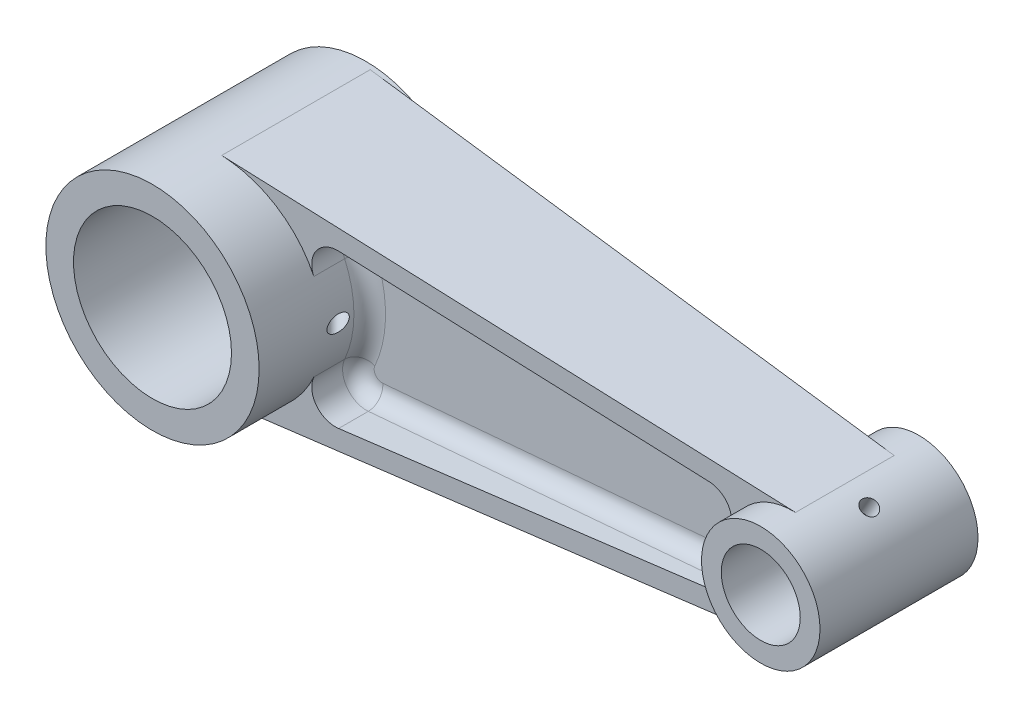
from build123d import *

# Parameters (mm, degrees)
SKETCH_2_R                  = 13.5
EXTRUDE_1_DEPTH             = 27
SKETCH_3_R                  = 7.5
EXTRUDE_2_DEPTH             = 20
EXTRUDE_START               = 10
EXTRUDE_3_DEPTH             = 3
EXTRUDE_4_REACH             = 83.17
EXTRUDE_4_DIRECTION_2_REACH = 83.17
FILLET_1_R                  = 3
SKETCH_7_R                  = 10
CUT_EXTRUDE_1_DEPTH         = 84.171509545
SKETCH_8_R                  = 5
CUT_EXTRUDE_2_DEPTH         = 82.169575581
SWEEP_1_PROFILE_R           = 1
FILLET_2_R                  = 2
SWEEP_2_PROFILE_R           = 1


with BuildPart() as part:
    # 草图2 → 凸台-拉伸1 (new body)
    with BuildSketch(Plane.XY):
        Circle(SKETCH_2_R)
    extrude(amount=EXTRUDE_1_DEPTH)



with BuildPart() as body_2:
    # 草图3 → 凸台-拉伸2 (new body)
    with BuildSketch(Plane.XY):
        with Locations((70, 0)):
            Circle(SKETCH_3_R)
    extrude(amount=EXTRUDE_2_DEPTH)


with BuildPart() as part_1:
    add(part.part)

    add(body_2.part)  # 凸台-拉伸3 merges body 2
    # 草图4 → 凸台-拉伸3 (add, symmetric)
    with BuildSketch(Plane.XY.offset(EXTRUDE_START)):
        with BuildLine():
            Line((70.642857143, 7.472398189), (1.157142857, 13.45031674))
            ThreePointArc((1.157142857, 13.45031674), (9.946643368, 9.127665951), (13.5, 0))
            ThreePointArc((13.5, 0), (9.946643368, -9.127665951), (1.157142857, -13.45031674))
            Line((1.157142857, -13.45031674), (70.642857143, -7.472398189))
            ThreePointArc((70.642857143, -7.472398189), (62.5, 0), (70.642857143, 7.472398189))
        make_face()
    extrude(amount=EXTRUDE_3_DEPTH, both=True)

    # 凸台-拉伸4: up to this plane
    extrude_4_end = Plane(origin=(-0.024742268, 0, 0.544329897), z_dir=(0.04540766091865002, 0, -0.9989685402102996))
    # 草图6 → 凸台-拉伸4 (add, up to the surface)
    with BuildSketch(Plane(origin=(0, 0, 7), x_dir=(-1, 0, 0), z_dir=(0, 0, -1)), mode=Mode.PRIVATE) as extrude_4_sk1:
        with BuildLine():
            Line((-8.740292619, -10.288696951), (-64.85897466, -5.460756216))
            ThreePointArc((-64.85897466, -5.460756216), (-67.536251811, -7.083780407), (-70.642857143, -7.472398189))
            Line((-70.642857143, -7.472398189), (-1.157142857, -13.45031674))
            ThreePointArc((-1.157142857, -13.45031674), (-5.195071431, -12.460386544), (-8.740292619, -10.288696951))
        make_face()
    extrude_4_tool1 = split(extrude(extrude_4_sk1.sketch, amount=EXTRUDE_4_REACH, mode=Mode.PRIVATE), bisect_by=extrude_4_end, keep=Keep.BOTH, mode=Mode.PRIVATE)
    add(extrude_4_tool1.solids().sort_by_distance((36.504922, -9.191046, 7))[0])
    # 草图6 → 凸台-拉伸4 (add, up to the surface)
    with BuildSketch(Plane(origin=(0, 0, 7), x_dir=(-1, 0, 0), z_dir=(0, 0, -1)), mode=Mode.PRIVATE) as extrude_4_sk2:
        with BuildLine():
            ThreePointArc((-70.642857143, 7.472398189), (-67.536251811, 7.083780407), (-64.85897466, 5.460756216))
            Line((-64.85897466, 5.460756216), (-8.740292619, 10.288696951))
            ThreePointArc((-8.740292619, 10.288696951), (-5.195071431, 12.460386544), (-1.157142857, 13.45031674))
            Line((-1.157142857, 13.45031674), (-70.642857143, 7.472398189))
        make_face()
    extrude_4_tool2 = split(extrude(extrude_4_sk2.sketch, amount=EXTRUDE_4_REACH, mode=Mode.PRIVATE), bisect_by=extrude_4_end, keep=Keep.BOTH, mode=Mode.PRIVATE)
    add(extrude_4_tool2.solids().sort_by_distance((36.504922, 9.191046, 7))[0])

    # 凸台-拉伸4 direction 2: up to this plane
    extrude_4_direction_2_end = Plane(origin=(0.882474227, 0, 19.41443299), z_dir=(0.04540766091865002, 0, 0.9989685402102996))
    # 草图6 → 凸台-拉伸4 direction 2 (add, up to the surface)
    with BuildSketch(Plane(origin=(0, 0, 7), x_dir=(-1, 0, 0), z_dir=(0, 0, -1)), mode=Mode.PRIVATE) as extrude_4_direction_2_sk1:
        with BuildLine():
            Line((-8.740292619, -10.288696951), (-64.85897466, -5.460756216))
            ThreePointArc((-64.85897466, -5.460756216), (-67.536251811, -7.083780407), (-70.642857143, -7.472398189))
            Line((-70.642857143, -7.472398189), (-1.157142857, -13.45031674))
            ThreePointArc((-1.157142857, -13.45031674), (-5.195071431, -12.460386544), (-8.740292619, -10.288696951))
        make_face()
    extrude_4_direction_2_tool1 = split(extrude(extrude_4_direction_2_sk1.sketch, amount=-EXTRUDE_4_DIRECTION_2_REACH, mode=Mode.PRIVATE), bisect_by=extrude_4_direction_2_end, keep=Keep.BOTH, mode=Mode.PRIVATE)
    add(extrude_4_direction_2_tool1.solids().sort_by_distance((36.504922, -9.191046, 7))[0])
    # 草图6 → 凸台-拉伸4 direction 2 (add, up to the surface)
    with BuildSketch(Plane(origin=(0, 0, 7), x_dir=(-1, 0, 0), z_dir=(0, 0, -1)), mode=Mode.PRIVATE) as extrude_4_direction_2_sk2:
        with BuildLine():
            ThreePointArc((-70.642857143, 7.472398189), (-67.536251811, 7.083780407), (-64.85897466, 5.460756216))
            Line((-64.85897466, 5.460756216), (-8.740292619, 10.288696951))
            ThreePointArc((-8.740292619, 10.288696951), (-5.195071431, 12.460386544), (-1.157142857, 13.45031674))
            Line((-1.157142857, 13.45031674), (-70.642857143, 7.472398189))
        make_face()
    extrude_4_direction_2_tool2 = split(extrude(extrude_4_direction_2_sk2.sketch, amount=-EXTRUDE_4_DIRECTION_2_REACH, mode=Mode.PRIVATE), bisect_by=extrude_4_direction_2_end, keep=Keep.BOTH, mode=Mode.PRIVATE)
    add(extrude_4_direction_2_tool2.solids().sort_by_distance((36.504922, 9.191046, 7))[0])

    # 圆角1
    fillet_1_edges = [part_1.edges().sort_by_distance(p)[0] for p in [
        (64.85897466, 5.460756216, 14.753205121),
        (64.85897466, -5.460756216, 14.753205121),
        (8.740292619, -10.288696951, 16.028629713),
        (8.740292619, 10.288696951, 16.028629713),
        (64.85897466, 5.460756216, 5.246794879),
        (64.85897466, -5.460756216, 5.246794879),
        (8.740292619, 10.288696951, 3.971370287),
        (8.740292619, -10.288696951, 3.971370287),
    ]]
    fillet(fillet_1_edges, radius=FILLET_1_R)

    # 草图7 → 切除-拉伸1 (cut, through all)
    with BuildSketch(Plane.XY.offset(27)):
        Circle(SKETCH_7_R)
    extrude(amount=-CUT_EXTRUDE_1_DEPTH, mode=Mode.SUBTRACT)

    # 草图8 → 切除-拉伸2 (cut, through all)
    with BuildSketch(Plane.XY.offset(20)):
        with Locations((70, 0)):
            Circle(SKETCH_8_R)
    extrude(amount=-CUT_EXTRUDE_2_DEPTH, mode=Mode.SUBTRACT)

    # 切除-扫描1: sweep along a path in 草图9
    with BuildLine(Plane.XY.offset(10)) as sweep_1_path:
        Line((80.612740311, 18.381805426), (70, 0))
        Line((70, 0), (59.967392381, -17.376986128))
    # 切除-扫描1 profile (on start of the path) → 切除-扫描1 (sweep, cut)
    with BuildSketch(Plane(origin=(80.612740311, 18.381805426, 10), x_dir=(-0.8660254037844363, 0.5000000000000043, 0), z_dir=(-0.5000000000000043, -0.8660254037844363, 0))):
        Circle(SWEEP_1_PROFILE_R)
    sweep(path=sweep_1_path.line, mode=Mode.SUBTRACT)

    # 圆角2
    fillet_2_edges = [part_1.edges().sort_by_distance(p)[0] for p in [
        (12.618571656, 8.472145341, 7),
        (13.202896031, 2.816653405, 7),
        (12.618571656, -8.472145341, 7),
        (37.739680086, -7.793853541, 7),
        (62.371228316, -4.579374952, 7),
        (62.5, 0, 7),
        (62.371228316, 4.579374952, 7),
        (37.739680086, 7.793853541, 7),
        (62.371228316, -4.579374952, 13),
        (37.739680086, -7.793853541, 13),
        (12.618571656, -8.472145341, 13),
        (13.202896031, 2.816653405, 13),
        (12.618571656, 8.472145341, 13),
        (37.739680086, 7.793853541, 13),
        (62.371228316, 4.579374952, 13),
        (62.5, 0, 13),
    ]]
    fillet(fillet_2_edges, radius=FILLET_2_R)

    # 切除-扫描2: sweep along a path in 草图17
    with BuildLine(Plane(origin=(0, 0, 0), x_dir=(1, 0, 0), z_dir=(0, 1, 0))) as sweep_2_path:
        Line((18.617298106, -22.117298106), (7.5, -11))
        Line((7.5, -11), (18.151791497, -0.348208503))
    # 切除-扫描2 profile (on start of the path) → 切除-扫描2 (sweep, cut)
    with BuildSketch(Plane(origin=(18.617298106, 0, 22.117298106), x_dir=(0.7071067811865389, 0, -0.7071067811865561), z_dir=(-0.7071067811865561, 0, -0.7071067811865389))):
        Circle(SWEEP_2_PROFILE_R)
    sweep(path=sweep_2_path.line, transition=Transition.RIGHT, mode=Mode.SUBTRACT)


solid = part_1.part
